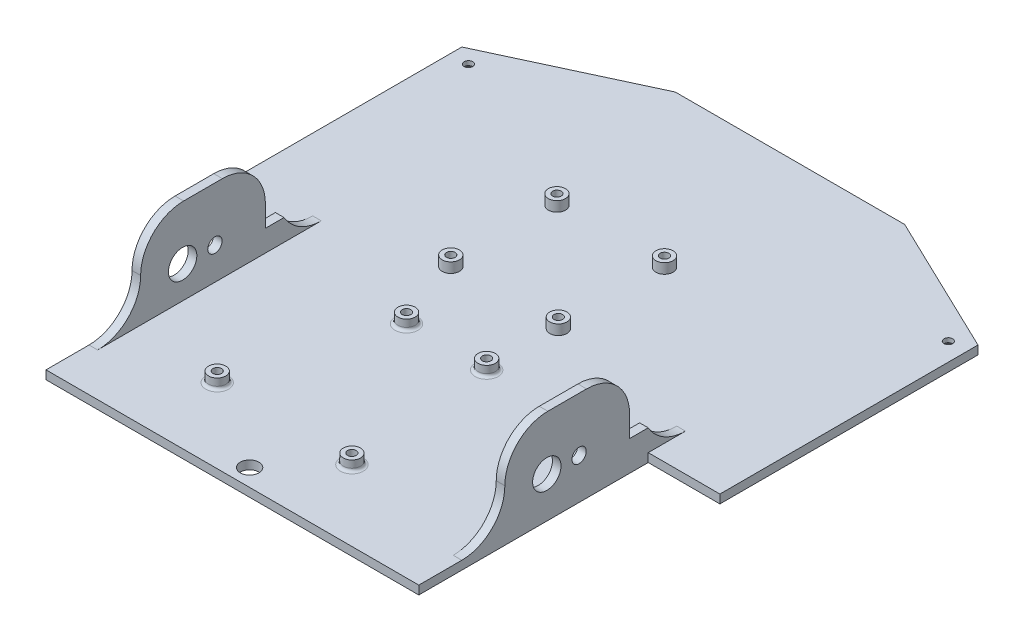
from build123d import *

# Parameters (mm, degrees)
SALIENTE_EXTRUIR1_DEPTH    = 3
CORTAR_EXTRUIR5_DEPTH      = 104
CORTAR_EXTRUIR5_DEPTH_BACK = 142
CROQUIS1_5_W               = 25
CROQUIS1_5_H               = 80
CROQUIS2_W                 = 3
CROQUIS2_H                 = 50
SALIENTE_EXTRUIR2_DEPTH    = 30
CROQUIS3_R                 = 4.95
CROQUIS3_R_2               = 2.5
CROQUIS3_W                 = 6.5
CROQUIS3_H                 = 22.5
CORTAR_EXTRUIR6_DEPTH      = 30
CROQUIS4_R                 = 3.25
CORTAR_EXTRUIR7_DEPTH      = 1.5
CROQUIS5_R                 = 3.25
CORTAR_EXTRUIR8_DEPTH      = 3
REDONDEO11_R               = 15
REDONDEO12_START           = -65
REDONDEO12_DEPTH           = 130
REDONDEO12_2_DEPTH         = 3
REDONDEO12_START_2         = 62
REDONDEO12_3_DEPTH         = 3
REDONDEO13_R               = 15
CROQUIS7_R                 = 3
CROQUIS7_R_2               = 1.5
SALIENTE_EXTRUIR4_DEPTH    = 3.5
REDONDEO14_R               = 1
CROQUIS10_R                = 1.5
CORTAR_EXTRUIR11_DEPTH     = 3.5
CROQUIS6_R                 = 3.5
CROQUIS6_R_2               = 2.25
CORTAR_EXTRUIR12_DEPTH     = 1.5


with BuildPart() as part:
    # Croquis1 → Saliente-Extruir1 (new body)
    with BuildSketch(Plane(origin=(0, 0, 0), x_dir=(1, 0, 0), z_dir=(0, 1, 0))):
        Polygon((-90, 85), (-90, -85), (90, -85), (90, 85), (40.810665128, 108.620102865), (-39.189334872, 108.620102865), align=None)
    extrude(amount=SALIENTE_EXTRUIR1_DEPTH)

    # Croquis1<5> → Cortar-Extruir5 (cut, two sides: drawn at the far end of the back side and taken through both)
    with BuildSketch(Plane(origin=(0, 0, 0), x_dir=(1, 0, 0), z_dir=(0, 1, 0)).offset(-CORTAR_EXTRUIR5_DEPTH_BACK)):
        with Locations((-77.5, -45)):
            Rectangle(CROQUIS1_5_W, CROQUIS1_5_H)
        with Locations((77.5, -45)):
            Rectangle(CROQUIS1_5_W, CROQUIS1_5_H)
    extrude(amount=CORTAR_EXTRUIR5_DEPTH + CORTAR_EXTRUIR5_DEPTH_BACK, mode=Mode.SUBTRACT)

    # Croquis2 → Saliente-Extruir2 (add)
    with BuildSketch(Plane(origin=(0, 3, 0), x_dir=(1, 0, 0), z_dir=(0, 1, 0))):
        with Locations((-63.5, -30)):
            Rectangle(CROQUIS2_W, CROQUIS2_H)
    saliente_extruir2 = extrude(amount=SALIENTE_EXTRUIR2_DEPTH)

    # Croquis3 → Cortar-Extruir6 (cut)
    with BuildSketch(Plane.ZY.offset(65)):
        with Locations((40.353471705, 14.22)):
            Circle(CROQUIS3_R)
        with Locations((29.103471705, 14.22)):
            Circle(CROQUIS3_R_2)
        with Locations((8.25, 21.75)):
            Rectangle(CROQUIS3_W, CROQUIS3_H)
    cortar_extruir6 = extrude(amount=-CORTAR_EXTRUIR6_DEPTH, mode=Mode.SUBTRACT)

    # Simetría2: Saliente-Extruir2 across plane
    add(saliente_extruir2.mirror(Plane(origin=(0, 0, 0), x_dir=(0, 0, 1), z_dir=(1, 0, 0))))

    # Simetría3: Cortar-Extruir6 across plane
    add(cortar_extruir6.mirror(Plane(origin=(0, 0, 0), x_dir=(0, 0, 1), z_dir=(1, 0, 0))), mode=Mode.SUBTRACT)

    # Croquis4 → Cortar-Extruir7 (cut)
    with BuildSketch(Plane.XZ):
        with Locations(Location((-83.676954094, -80.966503939, 0), (0, 0, 270))):
            Circle(CROQUIS4_R)
    cortar_extruir7 = extrude(amount=-CORTAR_EXTRUIR7_DEPTH, mode=Mode.SUBTRACT)

    # Simetría4: Cortar-Extruir7 across plane
    add(cortar_extruir7.mirror(Plane(origin=(0, 0, 0), x_dir=(0, 0, 1), z_dir=(1, 0, 0))), mode=Mode.SUBTRACT)

    # Croquis5 → Cortar-Extruir8 (cut)
    with BuildSketch(Plane(origin=(0, 0, 0), x_dir=(-1, 0, 0), z_dir=(0, -1, 0))):
        with Locations(Location((0, -79, 0), (0, 0, 90))):
            Circle(CROQUIS5_R)
    extrude(amount=-CORTAR_EXTRUIR8_DEPTH, mode=Mode.SUBTRACT)

    # Redondeo11
    # the kernel refuses this fillet: 15 mm, written as the material it adds along each edge
    with BuildSketch(Plane(origin=(-65, 3, 5), x_dir=(0, 0, -1), z_dir=(1, 0, 0))) as redondeo11_piece_1:
        with BuildLine():
            CenterArc((12.990381057, 15), REDONDEO11_R, 210, 60)
            Line((0, 7.5), (0, 0))
            Line((0, 0), (12.990381057, 0))
        make_face()
    extrude(amount=3)
    with BuildSketch(Plane(origin=(65, 3, 5), x_dir=(0, 0, -1), z_dir=(-1, 0, 0))) as redondeo11_piece_2:
        with BuildLine():
            CenterArc((12.990381057, -15), REDONDEO11_R, 90, 60)
            Line((0, -7.5), (0, 0))
            Line((0, 0), (12.990381057, 0))
        make_face()
    extrude(amount=3)

    # Redondeo12: read off the stored shape, not the designer's step
    # Redondeo12 outline → Redondeo12 (cut)
    with BuildSketch(Plane.YZ.offset(REDONDEO12_START)):
        with BuildLine():
            Line((33, 55), (18, 55))
            ThreePointArc((18, 55), (28.606601718, 50.606601718), (33, 40))
            Line((33, 40), (33, 55))
        make_face()
    extrude(amount=REDONDEO12_DEPTH, mode=Mode.SUBTRACT)

    # Redondeo12 2 outline → Redondeo12 2 (add)
    with BuildSketch(Plane.YZ.offset(REDONDEO12_START)):
        with BuildLine():
            Line((3, 55), (18, 55))
            ThreePointArc((18, 55), (7.393398282, 59.393398282), (3, 70))
            Line((3, 70), (3, 55))
        make_face()
    extrude(amount=REDONDEO12_2_DEPTH)

    # Redondeo12 3 outline → Redondeo12 3 (add)
    with BuildSketch(Plane.YZ.offset(REDONDEO12_START_2)):
        with BuildLine():
            Line((3, 55), (18, 55))
            ThreePointArc((18, 55), (7.393398282, 59.393398282), (3, 70))
            Line((3, 70), (3, 55))
        make_face()
    extrude(amount=REDONDEO12_3_DEPTH)

    # Redondeo13
    redondeo13_edges = [part.edges().sort_by_distance(p)[0] for p in [
        (63.5, 33, 11.5),
        (-63.5, 33, 11.5),
    ]]
    fillet(redondeo13_edges, radius=REDONDEO13_R)

    # Croquis7 → Saliente-Extruir4 (add)
    # profile 1 of 8: a face of its own
    with BuildSketch(Plane(origin=(0, 3, 0), x_dir=(1, 0, 0), z_dir=(0, 1, 0))):
        with Locations(Location((-31.3, -59, 0), (0, 0, 90))):
            Circle(CROQUIS7_R)
        with Locations(Location((-31.3, -59, 0), (0, 0, 270))):
            Circle(CROQUIS7_R_2, mode=Mode.SUBTRACT)
    # profile 2 of 8: a face of its own
    with BuildSketch(Plane(origin=(0, 3, 0), x_dir=(1, 0, 0), z_dir=(0, 1, 0))):
        with Locations(Location((16.94328658, -60.27, 0), (0, 0, 90))):
            Circle(CROQUIS7_R)
        with Locations(Location((16.94328658, -60.27, 0), (0, 0, 270))):
            Circle(CROQUIS7_R_2, mode=Mode.SUBTRACT)
    # profile 3 of 8: a face of its own
    with BuildSketch(Plane(origin=(0, 3, 0), x_dir=(1, 0, 0), z_dir=(0, 1, 0))):
        with Locations(Location((11.86328658, -8.2, 0), (0, 0, 90))):
            Circle(CROQUIS7_R)
        with Locations(Location((11.86328658, -8.2, 0), (0, 0, 270))):
            Circle(CROQUIS7_R_2, mode=Mode.SUBTRACT)
    # profile 4 of 8: a face of its own
    with BuildSketch(Plane(origin=(0, 3, 0), x_dir=(1, 0, 0), z_dir=(0, 1, 0))):
        with Locations(Location((-16.07671342, -8.2, 0), (0, 0, 90))):
            Circle(CROQUIS7_R)
        with Locations(Location((-16.07671342, -8.2, 0), (0, 0, 270))):
            Circle(CROQUIS7_R_2, mode=Mode.SUBTRACT)
    # profile 5 of 8: a face of its own
    with BuildSketch(Plane(origin=(0, 3, 0), x_dir=(1, 0, 0), z_dir=(0, 1, 0))):
        with Locations(Location((11.86328658, 16.8, 0), (0, 0, 90))):
            Circle(CROQUIS7_R)
        with Locations(Location((11.86328658, 16.8, 0), (0, 0, 270))):
            Circle(CROQUIS7_R_2, mode=Mode.SUBTRACT)
    # profile 6 of 8: a face of its own
    with BuildSketch(Plane(origin=(0, 3, 0), x_dir=(1, 0, 0), z_dir=(0, 1, 0))):
        with Locations(Location((11.86328658, 53.8, 0), (0, 0, 90))):
            Circle(CROQUIS7_R)
        with Locations(Location((11.86328658, 53.8, 0), (0, 0, 270))):
            Circle(CROQUIS7_R_2, mode=Mode.SUBTRACT)
    # profile 7 of 8: a face of its own
    with BuildSketch(Plane(origin=(0, 3, 0), x_dir=(1, 0, 0), z_dir=(0, 1, 0))):
        with Locations(Location((-25.63671342, 16.8, 0), (0, 0, 90))):
            Circle(CROQUIS7_R)
        with Locations(Location((-25.63671342, 16.8, 0), (0, 0, 270))):
            Circle(CROQUIS7_R_2, mode=Mode.SUBTRACT)
    # profile 8 of 8: a face of its own
    with BuildSketch(Plane(origin=(0, 3, 0), x_dir=(1, 0, 0), z_dir=(0, 1, 0))):
        with Locations(Location((-25.63671342, 53.8, 0), (0, 0, 90))):
            Circle(CROQUIS7_R)
        with Locations(Location((-25.63671342, 53.8, 0), (0, 0, 270))):
            Circle(CROQUIS7_R_2, mode=Mode.SUBTRACT)
    extrude(amount=SALIENTE_EXTRUIR4_DEPTH)

    # Redondeo14
    redondeo14_edges = [part.edges().sort_by_distance(p)[0] for p in [
        (-31.3, 3, 62),
        (16.94328658, 3, 63.27),
        (11.86328658, 3, 11.2),
        (-16.07671342, 3, 11.2),
    ]]
    fillet(redondeo14_edges, radius=REDONDEO14_R)

    # Croquis10 → Cortar-Extruir11 (cut)
    with BuildSketch(Plane.XZ.offset(-1.5)):
        with Locations(Location((-83.676954094, -80.966503939, 0), (0, 0, 270))):
            Circle(CROQUIS10_R)
    cortar_extruir11 = extrude(amount=-CORTAR_EXTRUIR11_DEPTH, mode=Mode.SUBTRACT)

    # Simetría5: Cortar-Extruir11 across plane
    add(cortar_extruir11.mirror(Plane(origin=(0, 0, 0), x_dir=(0, 0, 1), z_dir=(1, 0, 0))), mode=Mode.SUBTRACT)

    # Croquis6 → Cortar-Extruir12 (cut)
    # profile 1 of 2: a face of its own
    with BuildSketch(Plane.XZ):
        with Locations(Location((-13.189334872, -87.120102865, 0), (0, 0, 270))):
            Circle(CROQUIS6_R)
        with Locations(Location((-13.189334872, -87.120102865, 0), (0, 0, 270))):
            Circle(CROQUIS6_R_2, mode=Mode.SUBTRACT)
    # profile 2 of 2: a face of its own
    with BuildSketch(Plane.XZ):
        with Locations(Location((14.810665128, -87.120102865, 0), (0, 0, 270))):
            Circle(CROQUIS6_R)
        with Locations(Location((14.810665128, -87.120102865, 0), (0, 0, 270))):
            Circle(CROQUIS6_R_2, mode=Mode.SUBTRACT)
    extrude(amount=-CORTAR_EXTRUIR12_DEPTH, mode=Mode.SUBTRACT)


solid = part.part
